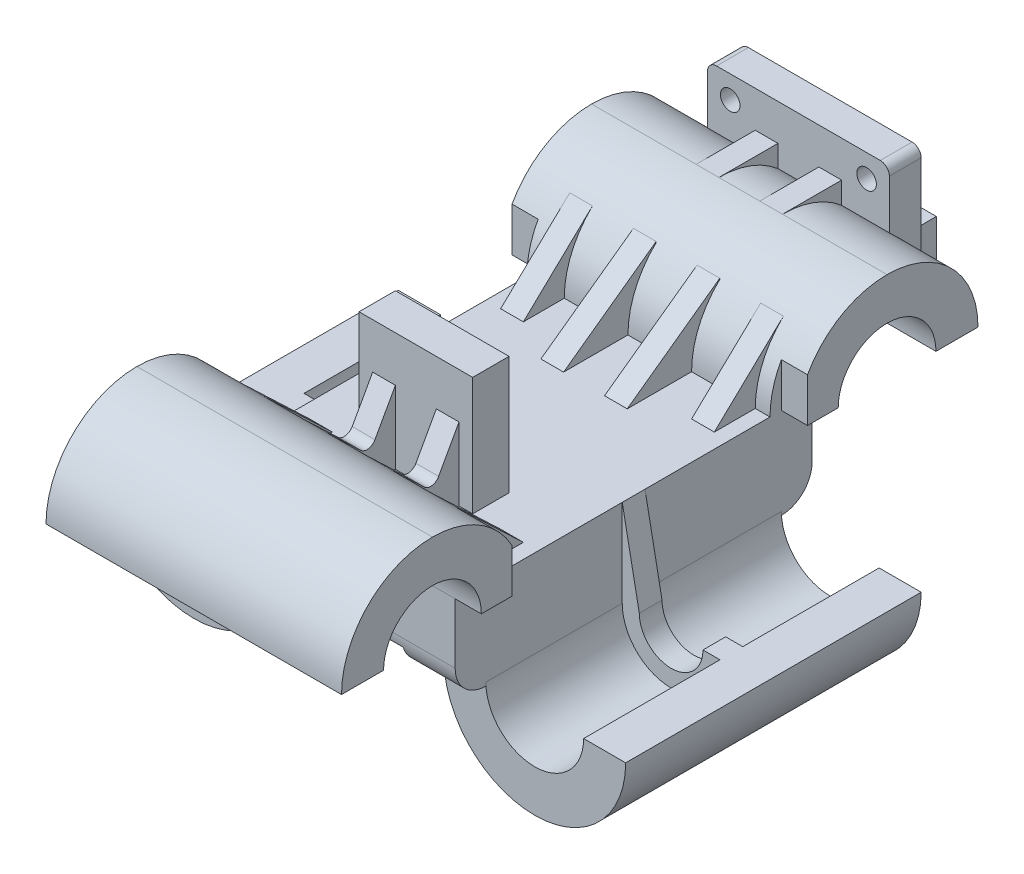
from build123d import *

# Parameters (mm, degrees)
SKETCH_1_W                = 65
SKETCH_1_H                = 140
EXTRUDE_1_DEPTH           = 45.5
SKETCH_3_R                = 10.75
CUT_EXTRUDE_1_DEPTH       = 30
CUT_EXTRUDE_START         = -30
SKETCH_2_R                = 10.75
CUT_EXTRUDE_2_DEPTH       = 30
SKETCH_4_R                = 7
CUT_EXTRUDE_3_DEPTH       = 5
SKETCH_5_W                = 65
SKETCH_5_H                = 20
EXTRUDE_2_DEPTH           = 25
SKETCH_6_W                = 65
SKETCH_6_H                = 20
EXTRUDE_3_DEPTH           = 25
EXTRUDE_4_REACH           = 124.761
SKETCH_8_W                = 65
SKETCH_8_H                = 13.75
CUT_EXTRUDE_4_DEPTH       = 30
CUT_EXTRUDE_5_DEPTH       = 30
CUT_EXTRUDE_6_REACH       = 105.115
FILLET_1_R                = 20
CUT_EXTRUDE_11_DEPTH      = 123.760946559
CUT_EXTRUDE_11_DEPTH_BACK = 123.760946559
SKETCH_13_W               = 37.5
SKETCH_13_H               = 5.5
FILLET_2_R                = 20
SKETCH_14_W               = 35
SKETCH_14_H               = 19.25
CUT_EXTRUDE_12_DEPTH      = 127.026782868
FILLET_3_R                = 20
SKETCH_15_W               = 60
SKETCH_15_H               = 20
CUT_EXTRUDE_13_DEPTH      = 122.302308305
FILLET_4_R                = 20
CUT_EXTRUDE_14_DEPTH      = 5.75
CUT_EXTRUDE_15_DEPTH      = 5.75
SKETCH_18_W               = 30.75
SKETCH_18_H               = 20
CUT_EXTRUDE_16_DEPTH      = 123.760946559
SKETCH_19_W               = 6.75
SKETCH_19_H               = 20
CUT_EXTRUDE_17_DEPTH      = 5.75
SKETCH_20_W               = 6.75
SKETCH_20_H               = 20
CUT_EXTRUDE_18_DEPTH      = 5.75
FILLET_5_R                = 6.75
SKETCH_21_W               = 25
SKETCH_21_H               = 8
EXTRUDE_5_DEPTH           = 26
EXTRUDE_6_DEPTH           = 2.5
EXTRUDE_7_DEPTH           = 2.5
EXTRUDE_8_DEPTH           = 2.5
EXTRUDE_9_DEPTH           = 2.5
EXTRUDE_10_DEPTH          = 2.5
EXTRUDE_11_DEPTH          = 2.5
FILLET_6_R                = 2
EXTRUDE_12_DEPTH          = 2.5
EXTRUDE_13_DEPTH          = 2.5
EXTRUDE_14_DEPTH          = 2.5
EXTRUDE_16_DEPTH          = 2.5
CUT_EXTRUDE_19_REACH      = 107.9
SKETCH_36_W               = 30
SKETCH_36_H               = 15
CUT_EXTRUDE_20_DEPTH      = 134.768690283
SKETCH_37_W               = 7
SKETCH_37_H               = 28
EXTRUDE_17_DEPTH          = 20
EXTRUDE_START             = 40
EXTRUDE_18_OUTLINE_W      = 5
EXTRUDE_18_OUTLINE_H      = 13
EXTRUDE_18_DEPTH          = 5.5
EXTRUDE_START_2           = 40.698684154
EXTRUDE_19_OUTLINE_W      = 5
EXTRUDE_19_OUTLINE_H      = 13
EXTRUDE_19_DEPTH          = 4.801315846
SKETCH_40_R               = 2.15
CUT_EXTRUDE_21_DEPTH      = 8
SKETCH_41_R               = 4
CUT_EXTRUDE_22_DEPTH      = 8
SKETCH_42_W               = 5
SKETCH_42_H               = 13
EXTRUDE_20_DEPTH          = 83
SKETCH_45_W               = 7
SKETCH_45_H               = 33
EXTRUDE_22_DEPTH          = 6.85
CUT_EXTRUDE_23_DEPTH      = 7
FILLET_10_R               = 2


with BuildPart() as part:
    # 草图1 → 凸台-拉伸1 (new body)
    with BuildSketch(Plane(origin=(0, 0, 0), x_dir=(1, 0, 0), z_dir=(0, 1, 0))):
        Rectangle(SKETCH_1_W, SKETCH_1_H)
    extrude(amount=EXTRUDE_1_DEPTH)

    # 草图3 → 切除-拉伸1 (cut)
    with BuildSketch(Plane.ZY.offset(32.5)):
        with Locations((-50, 25.5)):
            Circle(SKETCH_3_R)
        with Locations((50, 25.5)):
            Circle(SKETCH_3_R)
    extrude(amount=-CUT_EXTRUDE_1_DEPTH, mode=Mode.SUBTRACT)

    # 草图2 → 切除-拉伸2 (cut)
    with BuildSketch(Plane(origin=(32.5, 0, 0), x_dir=(0, 0, -1), z_dir=(1, 0, 0)).offset(CUT_EXTRUDE_START)):
        with Locations(Location((-50, 25.5, 0), (0, 0, 180))):
            Circle(SKETCH_2_R)
        with Locations(Location((50, 25.5, 0), (0, 0, 180))):
            Circle(SKETCH_2_R)
    extrude(amount=CUT_EXTRUDE_2_DEPTH, mode=Mode.SUBTRACT)

    # 草图4 → 切除-拉伸3 (cut)
    with BuildSketch(Plane(origin=(2.5, 0, 0), x_dir=(0, 0, -1), z_dir=(1, 0, 0))):
        with Locations((-50, 25.5)):
            Circle(SKETCH_4_R)
        with Locations((50, 25.5)):
            Circle(SKETCH_4_R)
    extrude(amount=-CUT_EXTRUDE_3_DEPTH, mode=Mode.SUBTRACT)

    # 草图5 → 凸台-拉伸2 (add)
    with BuildSketch(Plane(origin=(32.5, 0, 0), x_dir=(0, 0, -1), z_dir=(1, 0, 0))):
        with Locations((0, -3.75)):
            Rectangle(SKETCH_5_W, SKETCH_5_H)
    extrude(amount=EXTRUDE_2_DEPTH)

    # 草图6 → 凸台-拉伸3 (add)
    with BuildSketch(Plane.ZY.offset(32.5)):
        with Locations((0, -3.75)):
            Rectangle(SKETCH_6_W, SKETCH_6_H)
    extrude(amount=EXTRUDE_3_DEPTH)

    # 草图8 → 凸台-拉伸4 (add, up to next)
    with BuildSketch(Plane(origin=(-32.5, 0, 0), x_dir=(0, 0, -1), z_dir=(1, 0, 0)), mode=Mode.PRIVATE) as extrude_4_sk1:
        with Locations((0, -6.875)):
            Rectangle(SKETCH_8_W, SKETCH_8_H)
    extrude_4_tool1 = extrude(extrude_4_sk1.sketch, amount=EXTRUDE_4_REACH, mode=Mode.PRIVATE) - part.part
    add(extrude_4_tool1.solids().sort_by_distance((-32.5, -6.875, 0))[0])

    # 草图7 → 切除-拉伸4 (cut)
    with BuildSketch(Plane.XY.offset(32.5)):
        with BuildLine():
            Line((-26.75, 6.25), (-26.75, 45.5))
            Line((-26.75, 45.5), (-48.25, 45.5))
            Line((-48.25, 45.5), (-48.25, 6.25))
            ThreePointArc((-48.25, 6.25), (-37.5, -4.5), (-26.75, 6.25))
        make_face()
        with BuildLine():
            Line((48.25, 6.25), (48.25, 45.5))
            Line((48.25, 45.5), (26.75, 45.5))
            Line((26.75, 45.5), (26.75, 6.25))
            ThreePointArc((26.75, 6.25), (37.5, -4.5), (48.25, 6.25))
        make_face()
    extrude(amount=-CUT_EXTRUDE_4_DEPTH, mode=Mode.SUBTRACT)

    # 草图9 → 切除-拉伸5 (cut)
    with BuildSketch(Plane(origin=(0, 0, -32.5), x_dir=(-1, 0, 0), z_dir=(0, 0, -1)).offset(CUT_EXTRUDE_START)):
        with BuildLine():
            Line((-26.75, 6.25), (-26.75, 45.5))
            Line((-26.75, 45.5), (-48.25, 45.5))
            Line((-48.25, 45.5), (-48.25, 6.25))
            ThreePointArc((-48.25, 6.25), (-37.5, -4.5), (-26.75, 6.25))
        make_face()
        with BuildLine():
            Line((26.75, 6.25), (26.75, 45.5))
            Line((26.75, 45.5), (48.25, 45.5))
            Line((48.25, 45.5), (48.25, 6.25))
            ThreePointArc((48.25, 6.25), (37.5, -4.5), (26.75, 6.25))
        make_face()
    extrude(amount=CUT_EXTRUDE_5_DEPTH, mode=Mode.SUBTRACT)

    # 草图10 → 切除-拉伸6 (cut, up to next)
    with BuildSketch(Plane(origin=(0, 0, -2.5), x_dir=(-1, 0, 0), z_dir=(0, 0, -1)), mode=Mode.PRIVATE) as cut_extrude_6_sk1:
        with BuildLine():
            Line((-30.5, 6.25), (-30.5, 45.5))
            Line((-30.5, 45.5), (-44.5, 45.5))
            Line((-44.5, 45.5), (-44.5, 6.25))
            ThreePointArc((-44.5, 6.25), (-37.5, -0.75), (-30.5, 6.25))
        make_face()
    cut_extrude_6_tool1 = extrude(cut_extrude_6_sk1.sketch, amount=-CUT_EXTRUDE_6_REACH, mode=Mode.PRIVATE) & part.part
    # 草图10 → 切除-拉伸6 (cut, up to next)
    with BuildSketch(Plane(origin=(0, 0, -2.5), x_dir=(-1, 0, 0), z_dir=(0, 0, -1)), mode=Mode.PRIVATE) as cut_extrude_6_sk2:
        with BuildLine():
            Line((44.5, 6.25), (44.5, 45.5))
            Line((44.5, 45.5), (30.5, 45.5))
            Line((30.5, 45.5), (30.5, 6.25))
            ThreePointArc((30.5, 6.25), (37.5, -0.75), (44.5, 6.25))
        make_face()
    cut_extrude_6_tool2 = extrude(cut_extrude_6_sk2.sketch, amount=-CUT_EXTRUDE_6_REACH, mode=Mode.PRIVATE) & part.part
    add(cut_extrude_6_tool1.solids().sort_by_distance((37.5, 23.098831, -2.5))[0], mode=Mode.SUBTRACT)
    add(cut_extrude_6_tool2.solids().sort_by_distance((-37.5, 23.098831, -2.5))[0], mode=Mode.SUBTRACT)

    # 圆角1
    fillet_1_edges = [part.edges().sort_by_distance(p)[0] for p in [
        (-57.5, -13.75, 0),
        (0, 45.5, -70),
        (0, 45.5, 70),
        (57.5, -13.75, 0),
    ]]
    fillet(fillet_1_edges, radius=FILLET_1_R - 0.0001)  # a hair under: the kernel refuses the full size

    # 草图13 → 切除-拉伸11 (cut, two sides: drawn at the far end of the back side and taken through both)
    with BuildSketch(Plane(origin=(32.5, 0, 0), x_dir=(0, 0, -1), z_dir=(1, 0, 0)).offset(-CUT_EXTRUDE_11_DEPTH_BACK)):
        with Locations((-51.25, 2.75)):
            Rectangle(SKETCH_13_W, SKETCH_13_H)
        with Locations((51.25, 2.75)):
            Rectangle(SKETCH_13_W, SKETCH_13_H)
    extrude(amount=CUT_EXTRUDE_11_DEPTH + CUT_EXTRUDE_11_DEPTH_BACK, mode=Mode.SUBTRACT)

    # 圆角2
    fillet_2_edges = [part.edges().sort_by_distance(p)[0] for p in [
        (0, 5.5, -70),
        (0, 5.5, 70),
    ]]
    fillet(fillet_2_edges, radius=FILLET_2_R)

    # 草图14 → 切除-拉伸12 (cut, through all)
    with BuildSketch(Plane.XY.offset(32.5)):
        with Locations((0, -4.125)):
            Rectangle(SKETCH_14_W, SKETCH_14_H)
    extrude(amount=-CUT_EXTRUDE_12_DEPTH, mode=Mode.SUBTRACT)

    # 圆角3
    # the kernel refuses this fillet: 20 mm, written as the material it takes off along each edge
    with BuildSketch(Plane(origin=(-17.5, -13.75, 82.464831382), x_dir=(0, 1, 0), z_dir=(0, 0, -1))) as fillet_3_piece_1:
        with BuildLine():
            CenterArc((20, -19.985932553), FILLET_3_R, 92.149095627, 87.850904373)
            Line((0, -19.985932553), (-0.4, -19.985932553))
            Line((-0.4, -19.985932553), (-0.4, 0))
            Line((-0.4, 0), (0, 0.4))
            ThreePointArc((0, 0.4), (9.625, 0.4), (19.235, 0.399718651))
            Line((19.235, 0.399718651), (19.25, 0))
        make_face()
    extrude(amount=164.929662763, mode=Mode.SUBTRACT)
    with BuildSketch(Plane(origin=(17.5, -13.75, 82.464831382), x_dir=(1, 0, 0), z_dir=(0, 0, -1))) as fillet_3_piece_2:
        with BuildLine():
            CenterArc((19.985932553, -20), FILLET_3_R, 90, 87.850904373)
            Line((0, -19.25), (-0.399718651, -19.235))
            ThreePointArc((-0.399718651, -19.235), (-0.4, -9.625), (-0.4, 0))
            Line((-0.4, 0), (0, 0.4))
            Line((0, 0.4), (19.985932553, 0.4))
            Line((19.985932553, 0.4), (19.985932553, 0))
        make_face()
    extrude(amount=164.929662763, mode=Mode.SUBTRACT)

    # 草图15 → 切除-拉伸13 (cut, through all)
    with BuildSketch(Plane(origin=(30.5, 0, 0), x_dir=(0, 0, -1), z_dir=(1, 0, 0))):
        with Locations((0, 35.5)):
            Rectangle(SKETCH_15_W, SKETCH_15_H)
    extrude(amount=-CUT_EXTRUDE_13_DEPTH, mode=Mode.SUBTRACT)

    # 圆角4
    fillet_4_edges = [part.edges().sort_by_distance(p)[0] for p in [
        (0, 45.5, 30),
        (0, 45.5, -30),
    ]]
    fillet(fillet_4_edges, radius=FILLET_4_R - 0.0001)  # a hair under: the kernel refuses the full size

    # 草图16 → 切除-拉伸14 (cut)
    with BuildSketch(Plane(origin=(32.5, 0, 0), x_dir=(0, 0, -1), z_dir=(1, 0, 0))):
        with BuildLine():
            Line((-32.5, 15.817541634), (-32.5, 5.5))
            Line((-32.5, 5.5), (-50, 5.5))
            ThreePointArc((-50, 5.5), (-39.842469968, 8.271402156), (-32.5, 15.817541634))
        make_face()
        with BuildLine():
            Line((32.5, 15.817541634), (32.5, 5.5))
            Line((32.5, 5.5), (50, 5.5))
            ThreePointArc((50, 5.5), (39.842469968, 8.271402156), (32.5, 15.817541634))
        make_face()
    extrude(amount=-CUT_EXTRUDE_14_DEPTH, mode=Mode.SUBTRACT)

    # 草图17 → 切除-拉伸15 (cut)
    with BuildSketch(Plane.ZY.offset(32.5)):
        with BuildLine():
            Line((-50, 5.5), (-32.5, 5.5))
            Line((-32.5, 5.5), (-32.5, 15.817541634))
            ThreePointArc((-32.5, 15.817541634), (-39.842469968, 8.271402156), (-50, 5.5))
        make_face()
        with BuildLine():
            Line((32.5, 15.817541634), (32.5, 5.5))
            Line((32.5, 5.5), (50, 5.5))
            ThreePointArc((50, 5.5), (39.842469968, 8.271402156), (32.5, 15.817541634))
        make_face()
    extrude(amount=-CUT_EXTRUDE_15_DEPTH, mode=Mode.SUBTRACT)

    # 草图18 → 切除-拉伸16 (cut, through all)
    with BuildSketch(Plane(origin=(32.5, 0, 0), x_dir=(0, 0, -1), z_dir=(1, 0, 0))):
        with Locations((-54.625, 15.5)):
            Rectangle(SKETCH_18_W, SKETCH_18_H)
        with Locations((54.625, 15.5)):
            Rectangle(SKETCH_18_W, SKETCH_18_H)
    extrude(amount=-CUT_EXTRUDE_16_DEPTH, mode=Mode.SUBTRACT)

    # 草图19 → 切除-拉伸17 (cut)
    with BuildSketch(Plane(origin=(32.5, 0, 0), x_dir=(0, 0, -1), z_dir=(1, 0, 0))):
        with Locations((-35.875, 15.5)):
            Rectangle(SKETCH_19_W, SKETCH_19_H)
        with Locations((35.875, 15.5)):
            Rectangle(SKETCH_19_W, SKETCH_19_H)
    extrude(amount=-CUT_EXTRUDE_17_DEPTH, mode=Mode.SUBTRACT)

    # 草图20 → 切除-拉伸18 (cut)
    with BuildSketch(Plane.ZY.offset(32.5)):
        with Locations((-35.875, 15.5)):
            Rectangle(SKETCH_20_W, SKETCH_20_H)
        with Locations((35.875, 15.5)):
            Rectangle(SKETCH_20_W, SKETCH_20_H)
    extrude(amount=-CUT_EXTRUDE_18_DEPTH, mode=Mode.SUBTRACT)

    # 圆角5
    fillet_5_edges = [part.edges().sort_by_distance(p)[0] for p in [
        (0, 5.5, -39.25),
        (0, 5.5, 39.25),
    ]]
    fillet(fillet_5_edges, radius=FILLET_5_R - 0.0001)  # a hair under: the kernel refuses the full size

    # 草图21 → 凸台-拉伸5 (add)
    with BuildSketch(Plane(origin=(0, 25.5, 0), x_dir=(1, 0, 0), z_dir=(0, 1, 0))):
        with Locations((0, -17.15)):
            Rectangle(SKETCH_21_W, SKETCH_21_H)
    extrude(amount=EXTRUDE_5_DEPTH)

    # 草图25 → 凸台-拉伸6 (add, symmetric)
    with BuildSketch(Plane(origin=(21, 0, 0), x_dir=(0, 0, -1), z_dir=(1, 0, 0))):
        Polygon((-36.206896552, 39.982758621), (-36.206896552, 25.5), (-21, 25.5), align=None)
        Polygon((36.206896552, 39.982758621), (21, 25.5), (36.206896552, 25.5), align=None)
    extrude(amount=EXTRUDE_6_DEPTH, both=True)

    # 草图24 → 凸台-拉伸7 (add, symmetric)
    with BuildSketch(Plane(origin=(7, 0, 0), x_dir=(0, 0, -1), z_dir=(1, 0, 0))):
        Polygon((-36.206896552, 39.982758621), (-36.206896552, 25.5), (-21, 25.5), align=None)
        Polygon((36.206896552, 40.208355389), (36.206896552, 25.5), (15.85, 25.5), align=None)
    extrude(amount=EXTRUDE_7_DEPTH, both=True)

    # 草图23 → 凸台-拉伸8 (add, symmetric)
    with BuildSketch(Plane(origin=(-7, 0, 0), x_dir=(0, 0, -1), z_dir=(1, 0, 0))):
        Polygon((-36.206896552, 39.982758621), (-36.206896552, 25.5), (-21, 25.5), align=None)
        Polygon((36.206896552, 40.208355389), (15.85, 25.5), (36.206896552, 25.5), align=None)
    extrude(amount=EXTRUDE_8_DEPTH, both=True)

    # 草图22 → 凸台-拉伸9 (add, symmetric)
    with BuildSketch(Plane(origin=(-21, 0, 0), x_dir=(0, 0, -1), z_dir=(1, 0, 0))):
        Polygon((-36.206896552, 39.982758621), (-21, 25.5), (-36.206896552, 25.5), align=None)
        Polygon((36.206896552, 39.982758621), (21, 25.5), (36.206896552, 25.5), align=None)
    extrude(amount=EXTRUDE_9_DEPTH, both=True)

    # 草图27 → 凸台-拉伸10 (add, symmetric)
    with BuildSketch(Plane(origin=(7, 0, 0), x_dir=(0, 0, -1), z_dir=(1, 0, 0))):
        Polygon((-21.15, 41.5), (-30, 25.5), (-21.15, 25.5), align=None)
    extrude(amount=EXTRUDE_10_DEPTH, both=True)

    # 草图26 → 凸台-拉伸11 (add, symmetric)
    with BuildSketch(Plane(origin=(-7, 0, 0), x_dir=(0, 0, -1), z_dir=(1, 0, 0))):
        Polygon((-30, 25.5), (-21.15, 25.5), (-21.15, 41.5), align=None)
    extrude(amount=EXTRUDE_11_DEPTH, both=True)

    # 圆角6
    fillet_6_edges = [part.edges().sort_by_distance(p)[0] for p in [
        (7, 31.114035088, 26.894736842),
        (-7, 31.114035088, 26.894736842),
    ]]
    fillet(fillet_6_edges, radius=FILLET_6_R)

    # 草图29 → 凸台-拉伸12 (add, symmetric)
    with BuildSketch(Plane.XY.offset(21)):
        Polygon((-24.744383564, -9.165995893), (-7, 5.5), (-24.744383564, 5.5), align=None)
        Polygon((7, 5.5), (24.744383564, -9.165995893), (24.744383564, 5.5), align=None)
    extrude(amount=EXTRUDE_12_DEPTH, both=True)

    # 草图30 → 凸台-拉伸13 (add, symmetric)
    with BuildSketch(Plane.XY.offset(7)):
        Polygon((-24.744383564, 5.5), (-24.744383564, -9.165995893), (-7, 5.5), align=None)
        Polygon((7, 5.5), (24.744383564, -9.165995893), (24.744383564, 5.5), align=None)
    extrude(amount=EXTRUDE_13_DEPTH, both=True)

    # 草图32 → 凸台-拉伸14 (add, symmetric)
    with BuildSketch(Plane.XY.offset(-21)):
        Polygon((-24.744383564, 5.5), (-24.744383564, -9.165995893), (-7, 5.5), align=None)
        Polygon((7, 5.5), (24.744383564, -9.165995893), (24.744383564, 5.5), align=None)
    extrude(amount=EXTRUDE_14_DEPTH, both=True)

    # 草图34 → 凸台-拉伸16 (add, symmetric)
    with BuildSketch(Plane.XY.offset(-7)):
        Polygon((-24.744383564, -9.165995893), (-24.744383564, 5.5), (-7, 5.5), align=None)
        Polygon((24.744383564, -9.165995893), (24.744383564, 5.5), (7, 5.5), align=None)
    extrude(amount=EXTRUDE_16_DEPTH, both=True)

    # 草图35 → 切除-拉伸19 (cut, up to next)
    with BuildSketch(Plane.XY.offset(2.5), mode=Mode.PRIVATE) as cut_extrude_19_sk1:
        Polygon((-30.5, 6.25), (-26.75, 25.5), (-30.5, 25.5), align=None)
    cut_extrude_19_tool1 = extrude(cut_extrude_19_sk1.sketch, amount=-CUT_EXTRUDE_19_REACH, mode=Mode.PRIVATE) & part.part
    # 草图35 → 切除-拉伸19 (cut, up to next)
    with BuildSketch(Plane.XY.offset(2.5), mode=Mode.PRIVATE) as cut_extrude_19_sk2:
        Polygon((26.75, 25.5), (30.5, 6.25), (30.5, 25.5), align=None)
    cut_extrude_19_tool2 = extrude(cut_extrude_19_sk2.sketch, amount=-CUT_EXTRUDE_19_REACH, mode=Mode.PRIVATE) & part.part
    add(cut_extrude_19_tool1.solids().sort_by_distance((-29.25, 19.083333, 2.5))[0], mode=Mode.SUBTRACT)
    add(cut_extrude_19_tool2.solids().sort_by_distance((29.25, 19.083333, 2.5))[0], mode=Mode.SUBTRACT)

    # 草图36 → 切除-拉伸20 (cut, through all)
    with BuildSketch(Plane.XY.offset(39.25)):
        with Locations((0, 2.75)):
            Rectangle(SKETCH_36_W, SKETCH_36_H)
    extrude(amount=-CUT_EXTRUDE_20_DEPTH, mode=Mode.SUBTRACT)

    # 草图37 → 凸台-拉伸17 (add, symmetric)
    with BuildSketch(Plane(origin=(0, 0, 0), x_dir=(0, 0, -1), z_dir=(1, 0, 0))):
        with Locations((66.5, 39.5)):
            Rectangle(SKETCH_37_W, SKETCH_37_H)
    extrude(amount=EXTRUDE_17_DEPTH, both=True)

    # 凸台-拉伸18: read off the stored shape, not the designer's step
    # 凸台-拉伸18 outline → 凸台-拉伸18 (add)
    with BuildSketch(Plane(origin=(0, 0, 0), x_dir=(1, 0, 0), z_dir=(0, 1, 0)).offset(EXTRUDE_START)):
        with Locations((-7, 56.5)):
            Rectangle(EXTRUDE_18_OUTLINE_W, EXTRUDE_18_OUTLINE_H)
    extrude(amount=EXTRUDE_18_DEPTH)

    # 凸台-拉伸19: read off the stored shape, not the designer's step
    # 凸台-拉伸19 outline → 凸台-拉伸19 (add)
    with BuildSketch(Plane(origin=(0, 0, 0), x_dir=(1, 0, 0), z_dir=(0, 1, 0)).offset(EXTRUDE_START_2)):
        with Locations((7, 56.5)):
            Rectangle(EXTRUDE_19_OUTLINE_W, EXTRUDE_19_OUTLINE_H)
    extrude(amount=EXTRUDE_19_DEPTH)

    # 草图40 → 切除-拉伸21 (cut)
    with BuildSketch(Plane(origin=(0, 0, -70), x_dir=(-1, 0, 0), z_dir=(0, 0, -1))):
        with Locations((-15, 48.5)):
            Circle(SKETCH_40_R)
        with Locations((15, 48.5)):
            Circle(SKETCH_40_R)
        with Locations((-15, 30.5)):
            Circle(SKETCH_40_R)
        with Locations((15, 30.5)):
            Circle(SKETCH_40_R)
    extrude(amount=-CUT_EXTRUDE_21_DEPTH, mode=Mode.SUBTRACT)

    # 草图41 → 切除-拉伸22 (cut)
    with BuildSketch(Plane(origin=(0, 0, -62), x_dir=(-1, 0, 0), z_dir=(0, 0, -1))):
        with Locations((-15, 30.5)):
            Circle(SKETCH_41_R)
        with Locations((15, 30.5)):
            Circle(SKETCH_41_R)
    extrude(amount=-CUT_EXTRUDE_22_DEPTH, mode=Mode.SUBTRACT)

    # 草图42 → 凸台-拉伸20 (add)
    with BuildSketch(Plane(origin=(0, 0, -23.5), x_dir=(-1, 0, 0), z_dir=(0, 0, -1))):
        with Locations((15.65, -1)):
            Rectangle(SKETCH_42_W, SKETCH_42_H)
    extrude(amount=EXTRUDE_20_DEPTH)

    # 草图45 → 凸台-拉伸22 (add)
    with BuildSketch(Plane.ZY.offset(20)):
        with Locations((-66.5, 9)):
            Rectangle(SKETCH_45_W, SKETCH_45_H)
    extrude(amount=-EXTRUDE_22_DEPTH)

    # 草图46 → 切除-拉伸23 (cut)
    with BuildSketch(Plane(origin=(0, 0, -70), x_dir=(-1, 0, 0), z_dir=(0, 0, -1))):
        Polygon((13.15, 25.5), (15, 25.5), (15, 15.5), (13.15, 5.5), (13.15, 16.899635719), align=None)
        Polygon((18.15, 5.5), (20, 15.5), (20, -7.5), (18.15, -7.5), align=None)
    extrude(amount=-CUT_EXTRUDE_23_DEPTH, mode=Mode.SUBTRACT)

    # 圆角10
    fillet_10_edges = [part.edges().sort_by_distance(p)[0] for p in [
        (20, 53.5, -66.5),
        (-20, 53.5, -66.5),
    ]]
    fillet(fillet_10_edges, radius=FILLET_10_R)


solid = part.part
